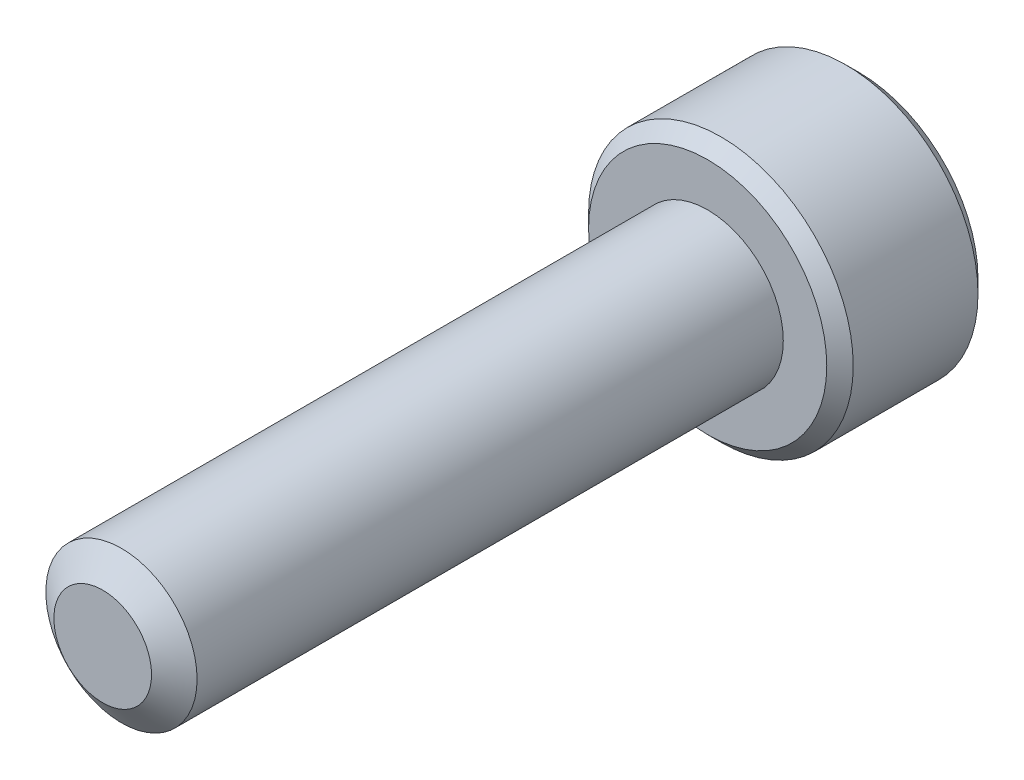
from build123d import *

# Parameters (mm, degrees)
SKETCH1_R          = 2
EXTRUDE1_DEPTH     = 16
SKETCH6_R          = 3.5
EXTRUDE2_DEPTH     = 4
CUT_EXTRUDE1_DEPTH = 2.25
CHAMFER1_SIZE      = 0.35


with BuildPart() as part:
    # Sketch1 → Extrude1 (new body)
    with BuildSketch(Plane.XY):
        Circle(SKETCH1_R)
    extrude(amount=-EXTRUDE1_DEPTH)

    # Sketch4 → Cut-Revolve1 (revolve, cut)
    with BuildSketch(Plane(origin=(0, 0, 0), x_dir=(0, 0, -1), z_dir=(1, 0, 0))):
        Polygon((0.496211411, 2), (0, 1.291336663), (0, 2), align=None)
    revolve(axis=Axis((0, 0, 0), (0, 0, -1)), mode=Mode.SUBTRACT)

    # Sketch6 → Extrude2 (add)
    with BuildSketch(Plane(origin=(0, 0, -16), x_dir=(-1, 0, 0), z_dir=(0, 0, -1))):
        Circle(SKETCH6_R)
    extrude(amount=EXTRUDE2_DEPTH)

    # Sketch7 → Cut-Extrude1 (cut)
    with BuildSketch(Plane(origin=(0, 0, -20), x_dir=(-1, 0, 0), z_dir=(0, 0, -1))):
        Polygon((0, 1.732050808), (-1.5, 0.866025404), (-1.5, -0.866025404), (0, -1.732050808), (1.5, -0.866025404), (1.5, 0.866025404), align=None)
    extrude(amount=-CUT_EXTRUDE1_DEPTH, mode=Mode.SUBTRACT)

    # Cut-Extrude2 cone 1 section (through the dimple's axis) → Cut-Extrude2 (revolve, cut)
    with BuildSketch(Plane(origin=(0, 0, -20), x_dir=(0, 1, 0), z_dir=(1, 0, 0))):
        Polygon((0, 0), (1.732050808, 0), (0, 1.732050808), align=None)
    revolve(axis=Axis((0, 0, -20), (0, 0, 1)), mode=Mode.SUBTRACT)

    # Chamfer1
    chamfer1_edges = [part.edges().sort_by_distance(p)[0] for p in [
        (3.5, 0, -20),
        (3.5, 0, -16),
    ]]
    chamfer(chamfer1_edges, length=CHAMFER1_SIZE)


solid = part.part
